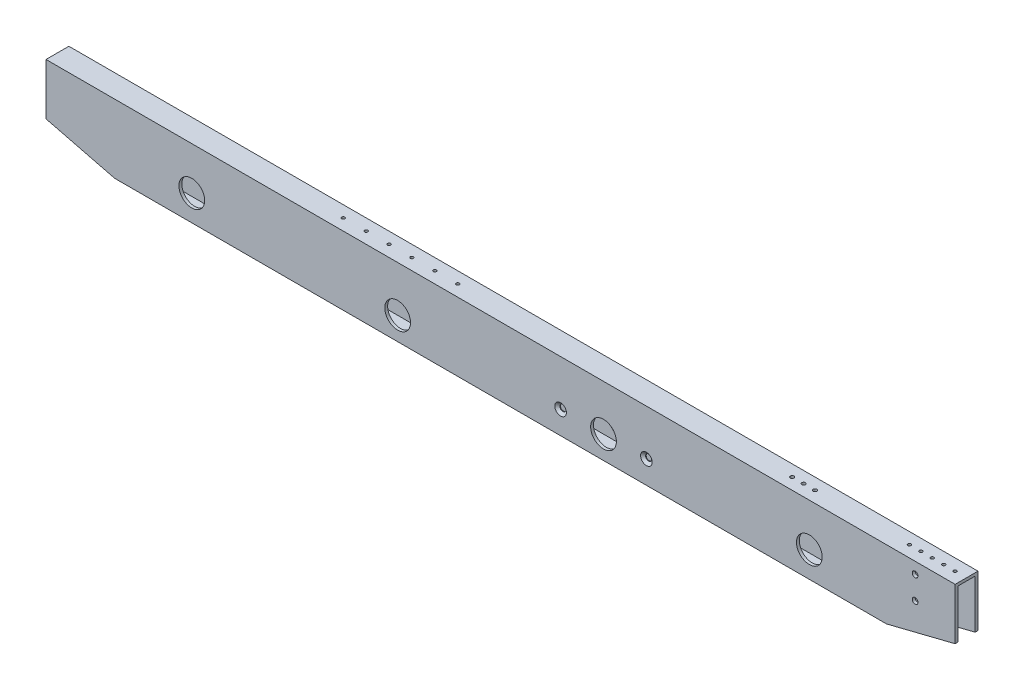
from build123d import *

# Parameters (mm, degrees)
SKETCH1_W                                           = 1009.65
SKETCH1_H                                           = 76.2
SKETCH1_R                                           = 14.2875
BOSS_EXTRUDE2_DEPTH                                 = 12.7
SKETCH3_W                                           = 19.05
SKETCH3_H                                           = 69.85
CUT_EXTRUDE2_DEPTH                                  = 1011.448426442
CUT_EXTRUDE3_DEPTH                                  = 507.897475457
SKETCH9_R                                           = 1.7272
CUT_EXTRUDE4_DEPTH                                  = 2.54
SKETCH12_R                                          = 1.7272
CUT_EXTRUDE7_DEPTH                                  = 5.08
CSK_FOR_1_4_FLAT_HEAD_MACHINE_SCREW_100_D           = 6.7564
CSK_FOR_1_4_FLAT_HEAD_MACHINE_SCREW_100_CSINK_D     = 12.8778
CSK_FOR_1_4_FLAT_HEAD_MACHINE_SCREW_100_CSINK_ANGLE = 100
CUT_EXTRUDE8_START                                  = -6.35
SKETCH17_R                                          = 1.7272
CUT_EXTRUDE8_DEPTH                                  = 6.35
SKETCH18_R                                          = 17.4625
CUT_EXTRUDE9_DEPTH                                  = 3.81
F_1_4_0_25_DIAMETER_HOLE1_D                         = 6.35
F_10_32_TAPPED_HOLE2_D                              = 4.0386


with BuildPart() as part:
    # Sketch1 → Boss-Extrude2 (new, symmetric)
    with BuildSketch(Plane.XY):
        Rectangle(SKETCH1_W, SKETCH1_H)
        with Locations((-114.3, -12.7)):
            Circle(SKETCH1_R, mode=Mode.SUBTRACT)
        with Locations((114.3, -12.7)):
            Circle(SKETCH1_R, mode=Mode.SUBTRACT)
        with Locations((-342.9, -9.525)):
            Circle(SKETCH1_R, mode=Mode.SUBTRACT)
        with Locations((342.9, -9.525)):
            Circle(SKETCH1_R, mode=Mode.SUBTRACT)
    extrude(amount=BOSS_EXTRUDE2_DEPTH, both=True)

    # Sketch3 → Cut-Extrude2 (cut, through all)
    with BuildSketch(Plane(origin=(504.825, 0, 0), x_dir=(0, 0, -1), z_dir=(1, 0, 0))):
        Rectangle(SKETCH3_W, SKETCH3_H)
    extrude(amount=-CUT_EXTRUDE2_DEPTH, mode=Mode.SUBTRACT)

    # Sketch4 → Cut-Extrude3 (cut, through all)
    with BuildSketch(Plane.XY.offset(12.7)):
        Polygon((-504.825, -38.1), (-504.825, -19.05), (-428.625, -38.1), align=None)
        Polygon((428.625, -38.1), (504.825, -38.1), (504.825, -19.05), align=None)
    extrude(amount=-CUT_EXTRUDE3_DEPTH, mode=Mode.SUBTRACT)

    # Sketch9 → Cut-Extrude4 (cut)
    with BuildSketch(Plane(origin=(0, 38.1, 0), x_dir=(1, 0, 0), z_dir=(0, 1, 0))):
        with Locations((492.125, 0)):
            Circle(SKETCH9_R)
        with Locations((479.425, 0)):
            Circle(SKETCH9_R)
        with Locations((466.725, 0)):
            Circle(SKETCH9_R)
        with Locations((454.025, 0)):
            Circle(SKETCH9_R)
        with Locations((441.325, 0)):
            Circle(SKETCH9_R)
    extrude(amount=-CUT_EXTRUDE4_DEPTH, mode=Mode.SUBTRACT)

    # Sketch12 → Cut-Extrude7 (cut)
    with BuildSketch(Plane(origin=(0, 38.1, 0), x_dir=(1, 0, 0), z_dir=(0, 1, 0))):
        with Locations((-187.325, 0)):
            Circle(SKETCH12_R)
        with Locations((-161.925, 0)):
            Circle(SKETCH12_R)
        with Locations((-136.525, 0)):
            Circle(SKETCH12_R)
        with Locations((-111.125, 0)):
            Circle(SKETCH12_R)
        with Locations((-85.725, 0)):
            Circle(SKETCH12_R)
        with Locations((-60.325, 0)):
            Circle(SKETCH12_R)
    extrude(amount=-CUT_EXTRUDE7_DEPTH, mode=Mode.SUBTRACT)

    # CSK for 1/4 Flat Head Machine Screw (100)2 (through all)
    with Locations(Plane.XY.offset(12.7)):
        with Locations((66.675, -12.7), (161.925, -12.7)):
            CounterSinkHole(CSK_FOR_1_4_FLAT_HEAD_MACHINE_SCREW_100_D / 2, CSK_FOR_1_4_FLAT_HEAD_MACHINE_SCREW_100_CSINK_D / 2, counter_sink_angle=CSK_FOR_1_4_FLAT_HEAD_MACHINE_SCREW_100_CSINK_ANGLE)

    # Sketch17 → Cut-Extrude8 (cut)
    with BuildSketch(Plane(origin=(0, -38.1, 0), x_dir=(-1, 0, 0), z_dir=(0, -1, 0)).offset(CUT_EXTRUDE8_START)):
        with Locations((-396.875, 0)):
            Circle(SKETCH17_R)
        with Locations((-320.675, 0)):
            Circle(SKETCH17_R)
        with Locations((-244.475, 0)):
            Circle(SKETCH17_R)
        with Locations((-168.275, 0)):
            Circle(SKETCH17_R)
        with Locations((-92.075, 0)):
            Circle(SKETCH17_R)
        with Locations((-15.875, 0)):
            Circle(SKETCH17_R)
        with Locations((60.325, 0)):
            Circle(SKETCH17_R)
    extrude(amount=CUT_EXTRUDE8_DEPTH, mode=Mode.SUBTRACT)

    # Sketch18 → Cut-Extrude9 (cut)
    with BuildSketch(Plane(origin=(0, 0, -12.7), x_dir=(-1, 0, 0), z_dir=(0, 0, -1))):
        with Locations((-114.3, -12.7)):
            Circle(SKETCH18_R)
    extrude(amount=-CUT_EXTRUDE9_DEPTH, mode=Mode.SUBTRACT)

    # 1/4 (0.25) Diameter Hole1 (through all)
    with Locations(Plane.XY.offset(12.7)):
        with Locations((460.375, 25.4), (460.375, 0)):
            Hole(F_1_4_0_25_DIAMETER_HOLE1_D / 2)

    # #10-32 Tapped Hole2 (through all)
    with Locations(Plane(origin=(0, 38.1, 0), x_dir=(1, 0, 0), z_dir=(0, 1, 0))):
        with Locations((336.55, 0), (323.85, 0), (311.15, 0)):
            Hole(F_10_32_TAPPED_HOLE2_D / 2)


solid = part.part
